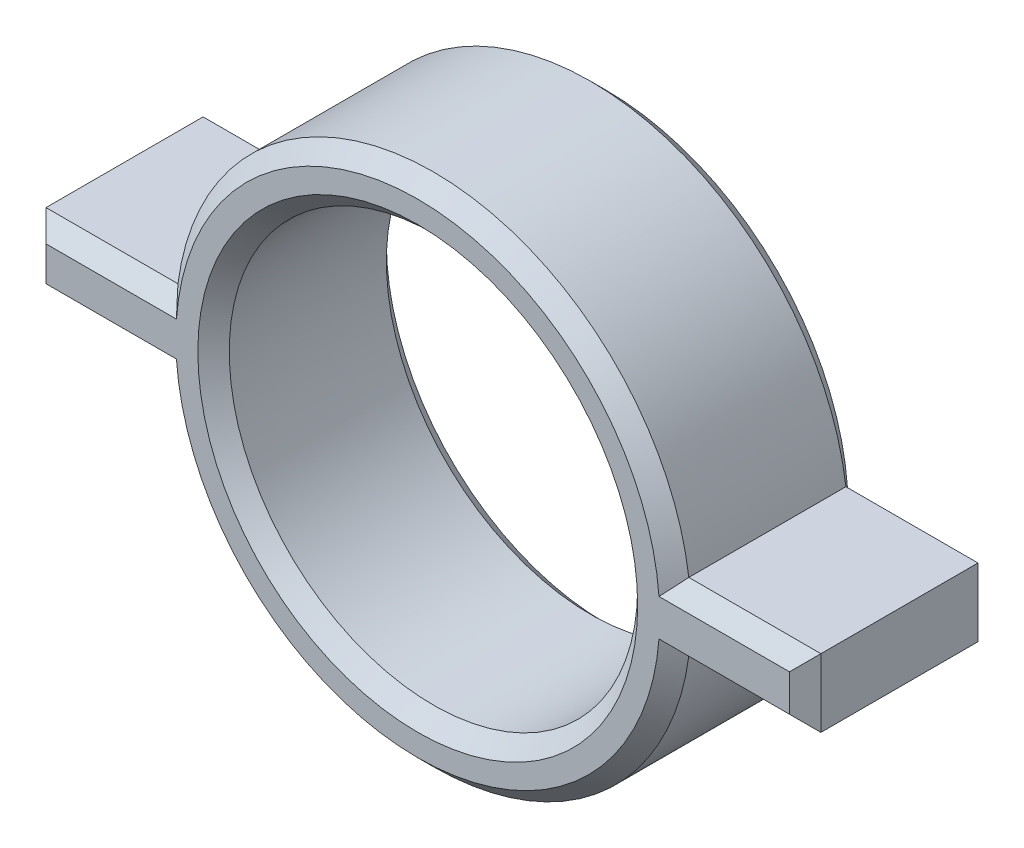
from build123d import *

# Parameters (mm, degrees)
SKETCH1_R           = 6.5
BOSS_EXTRUDE1_DEPTH = 6
CHAMFER1_SIZE       = 0.5


with BuildPart() as part:
    # Sketch1 → Boss-Extrude1 (new body)
    with BuildSketch(Plane.XY):
        with BuildLine():
            Line((8.127861753, -1.085294118), (12.332496542, -1.085294118))
            Line((12.332496542, -1.085294118), (12.332496542, 1.085294118))
            Line((12.332496542, 1.085294118), (8.127861753, 1.085294118))
            ThreePointArc((8.127861753, 1.085294118), (-0.017798567, 8.199980684), (-8.132496542, 1.05))
            Line((-8.132496542, 1.05), (-12.332496542, 1.05))
            Line((-12.332496542, 1.05), (-12.332496542, -1.05))
            Line((-12.332496542, -1.05), (-8.132496542, -1.05))
            ThreePointArc((-8.132496542, -1.05), (-0.017798567, -8.199980684), (8.127861753, -1.085294118))
        make_face()
        Circle(SKETCH1_R, mode=Mode.SUBTRACT)
    extrude(amount=BOSS_EXTRUDE1_DEPTH)

    # Chamfer1
    chamfer1_edges = [part.edges().sort_by_distance(p)[0] for p in [
        (-6.5, 0, 0),
        (-12.332496542, 0, 0),
        (-10.232496542, -1.05, 0),
        (-0.017798567, -8.199980684, 0),
        (10.230179147, -1.085294118, 0),
        (12.332496542, 0, 0),
        (10.230179147, 1.085294118, 0),
        (-0.017798567, 8.199980684, 0),
        (-10.232496542, 1.05, 0),
        (-6.5, 0, 6),
        (-0.017798567, 8.199980684, 6),
        (10.230179147, 1.085294118, 6),
        (12.332496542, 0, 6),
        (10.230179147, -1.085294118, 6),
        (-0.017798567, -8.199980684, 6),
        (-10.232496542, -1.05, 6),
        (-12.332496542, 0, 6),
        (-10.232496542, 1.05, 6),
    ]]
    chamfer(chamfer1_edges, length=CHAMFER1_SIZE)


solid = part.part
